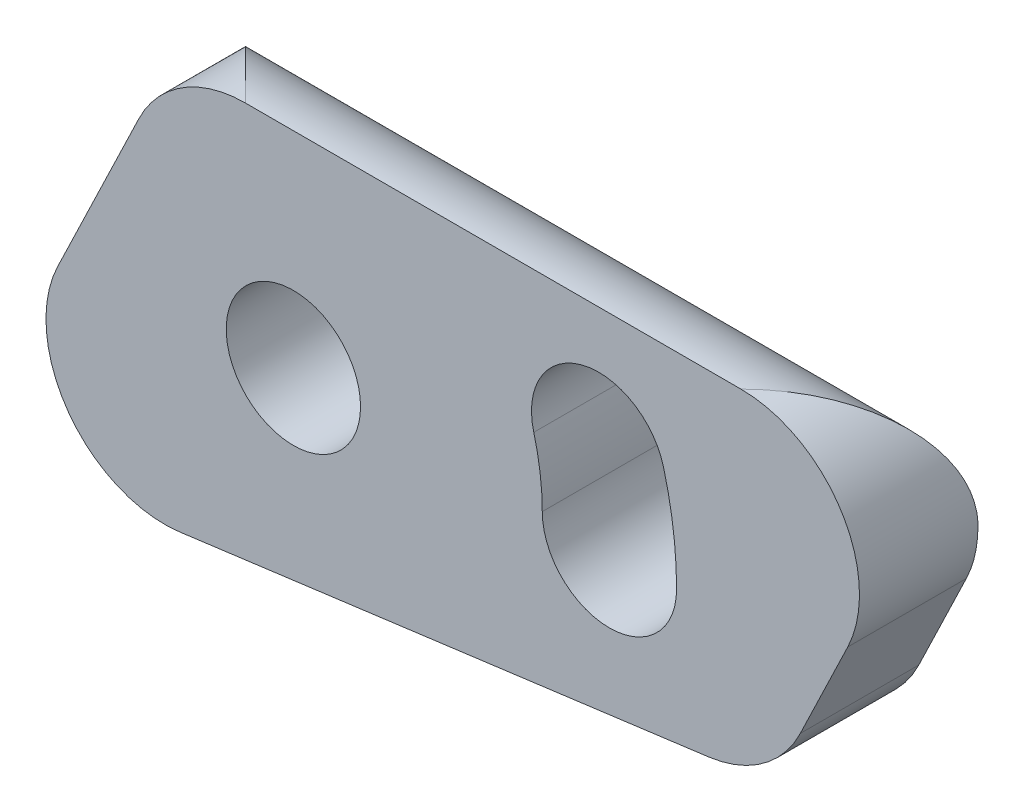
from build123d import *

# Parameters (mm, degrees)
ESQUISSE1_R             = 1.7
BOSS_EXTRU_1_DEPTH      = 3
ENL_V_MAT_EXTRU_1_DEPTH = 25.197605652
CONG_1_R                = 3
CONG_2_R                = 3


with BuildPart() as part:
    # Esquisse1 → Boss.-Extru.1 (new body)
    with BuildSketch(Plane.XY):
        Polygon((12.594874651, 9.115771584), (-7.904447763, 6.416984589), (-2.628489378, 17.375533229), (16.571510622, 17.375533229), align=None)
        with Locations((8.467987162, 12.175533229)):
            Circle(ESQUISSE1_R, mode=Mode.SUBTRACT)
        with Locations((0.467987162, 12.175533229)):
            Circle(ESQUISSE1_R, mode=Mode.SUBTRACT)
    extrude(amount=BOSS_EXTRU_1_DEPTH)

    # Esquisse2 → Enlèv. mat.-Extru.1 (cut, through all)
    with BuildSketch(Plane.XY.offset(3)):
        with BuildLine():
            ThreePointArc((6.767987162, 12.175533229), (6.714089789, 12.99784824), (6.553319868, 13.806093213))
            ThreePointArc((6.553319868, 13.806093213), (7.755401396, 15.888159494), (9.837467677, 14.686077966))
            ThreePointArc((9.837467677, 14.686077966), (10.085002318, 13.441637293), (10.167987162, 12.175533229))
            ThreePointArc((10.167987162, 12.175533229), (8.467987162, 10.475533229), (6.767987162, 12.175533229))
        make_face()
    extrude(amount=-ENL_V_MAT_EXTRU_1_DEPTH, mode=Mode.SUBTRACT)

    # Congé1
    cong_1_edges = [part.edges().sort_by_distance(p)[0] for p in [
        (-2.628489378, 17.375533229, 1.5),
        (16.571510622, 17.375533229, 1.5),
        (12.594874651, 9.115771584, 1.5),
        (-7.904447763, 6.416984589, 1.5),
    ]]
    fillet(cong_1_edges, radius=CONG_1_R)

    # Congé2
    # the kernel refuses this fillet: 3 mm, written as the material it takes off along each edge
    with BuildSketch(Plane(origin=(-8.243247375, 17.375533229, 0), x_dir=(0, -1, 0), z_dir=(1, 0, 0))) as cong_2_piece_1:
        with BuildLine():
            CenterArc((CONG_2_R, -CONG_2_R), CONG_2_R, 90, 90)
            Line((0, -CONG_2_R), (0, 0))
            Line((0, 0), (CONG_2_R, 0))
        make_face()
    extrude(amount=27.54083508, mode=Mode.SUBTRACT)


solid = part.part
